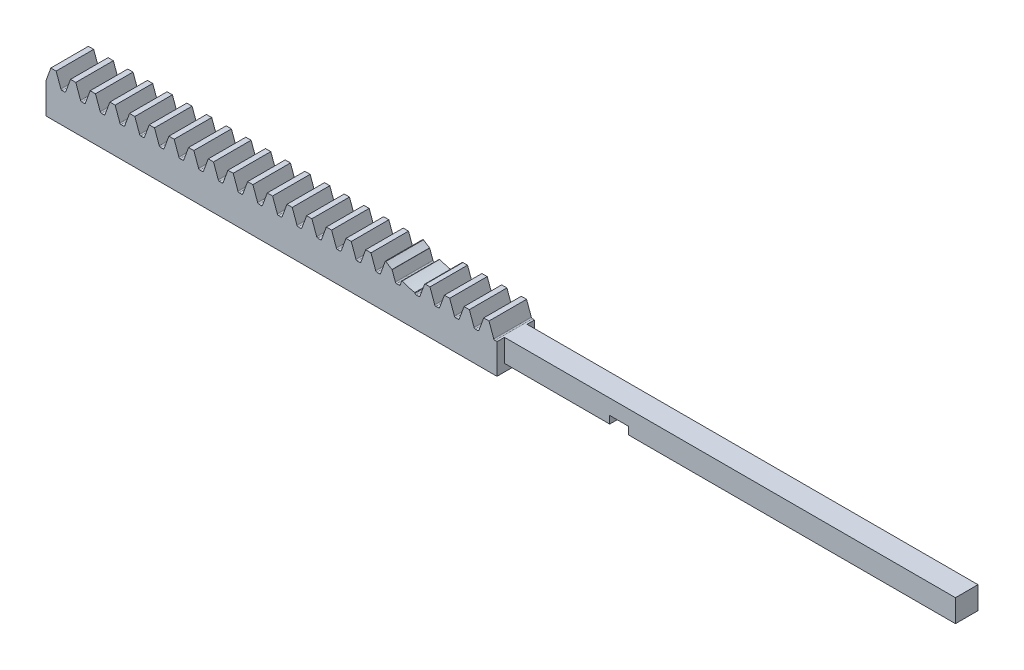
from build123d import *

# Parameters (mm, degrees)
SKETCH1_W                       = 609.6
SKETCH1_H                       = 25.4
BOSS_EXTRUDE1_DEPTH             = 12.7
CUT_EXTRUDE1_DEPTH              = 25.4
FILLET3_R                       = 0.43167355
LPATTERN4_START                 = -12.7
LPATTERN4_DEPTH                 = 25.4
SKETCH5_W                       = 609.6
SKETCH5_H                       = 25.4
CUT_EXTRUDE2_DEPTH              = 10.532533418
SKETCH6_W                       = 609.6
SKETCH6_H                       = 15.910853878
CUT_EXTRUDE3_DEPTH              = 12.7
SKETCH7_W                       = 12.7
SKETCH7_H                       = 14.867466582
CUT_EXTRUDE4_DEPTH              = 457.2
F_1_4_0_25_DIAMETER_HOLE1_D     = 6.35
F_1_4_0_25_DIAMETER_HOLE1_DEPTH = 12.7
F_1_4_0_25_DIAMETER_HOLE1_TIP   = 1.907732465
SKETCH20_W                      = 7.62
SKETCH20_H                      = 7.62
BOSS_EXTRUDE2_DEPTH             = 152.4
CUT_EXTRUDE6_DEPTH              = 12.7
CHAMFER1_SIZE                   = 0.127
CHAMFER1_SIZE2                  = 0.212490963
FILLET4_R                       = 0.127
SKETCH25_W                      = 6.35
SKETCH25_H                      = 7.62
CUT_EXTRUDE7_DEPTH              = 2.54


# Read off the part's stored shape, not the designer's step: LPattern4
with BuildPart() as part:
    # Sketch1 → Boss-Extrude1 (new, symmetric)
    with BuildSketch(Plane.XY):
        Rectangle(SKETCH1_W, SKETCH1_H)
    extrude(amount=BOSS_EXTRUDE1_DEPTH, both=True)

    # Sketch2 → Cut-Extrude1 (cut)
    with BuildSketch(Plane.XY.offset(12.7)):
        Polygon((-303.015947325, 12.7), (-301.30256958, 7.992533333), (-299.863657745, 7.992533333), (-298.15028, 12.7), align=None)
    extrude(amount=-CUT_EXTRUDE1_DEPTH, mode=Mode.SUBTRACT)

    # Fillet3
    fillet3_edges = [part.edges().sort_by_distance(p)[0] for p in [
        (-299.863657745, 7.992533333, 0),
        (-301.30256958, 7.992533333, 0),
    ]]
    fillet(fillet3_edges, radius=FILLET3_R)

    # LPattern4 outline → LPattern4 (cut)
    with BuildSketch(Plane.XY.offset(LPATTERN4_START)):
        with BuildLine():
            ThreePointArc((-294.756228955, 8.276565834), (-294.598186282, 8.070600612), (-294.350588506, 7.992533333))
            Line((-294.350588506, 7.992533333), (-293.516198819, 7.992533333))
            ThreePointArc((-293.516198819, 7.992533333), (-293.268601043, 8.070600612), (-293.11055837, 8.276565834))
            Line((-293.11055837, 8.276565834), (-291.50056, 12.7))
            Line((-291.50056, 12.7), (-296.366227325, 12.7))
            Line((-296.366227325, 12.7), (-294.756228955, 8.276565834))
        make_face()
        with BuildLine():
            Line((304.8, 12.7), (302.108572675, 12.7))
            Line((302.108572675, 12.7), (303.718571045, 8.276565834))
            ThreePointArc((303.718571045, 8.276565834), (303.876613718, 8.070600612), (304.124211494, 7.992533333))
            Line((304.124211494, 7.992533333), (304.8, 7.992533333))
            Line((304.8, 7.992533333), (304.8, 12.7))
        make_face()
        with BuildLine():
            Line((300.32452, 12.7), (295.458852675, 12.7))
            Line((295.458852675, 12.7), (297.068851045, 8.276565834))
            ThreePointArc((297.068851045, 8.276565834), (297.226893718, 8.070600612), (297.474491494, 7.992533333))
            Line((297.474491494, 7.992533333), (298.308881181, 7.992533333))
            ThreePointArc((298.308881181, 7.992533333), (298.556478957, 8.070600612), (298.71452163, 8.276565834))
            Line((298.71452163, 8.276565834), (300.32452, 12.7))
        make_face()
        with BuildLine():
            Line((293.6748, 12.7), (288.809132675, 12.7))
            Line((288.809132675, 12.7), (290.419131045, 8.276565834))
            ThreePointArc((290.419131045, 8.276565834), (290.577173718, 8.070600612), (290.824771494, 7.992533333))
            Line((290.824771494, 7.992533333), (291.659161181, 7.992533333))
            ThreePointArc((291.659161181, 7.992533333), (291.906758957, 8.070600612), (292.06480163, 8.276565834))
            Line((292.06480163, 8.276565834), (293.6748, 12.7))
        make_face()
        with BuildLine():
            Line((287.02508, 12.7), (282.159412675, 12.7))
            Line((282.159412675, 12.7), (283.769411045, 8.276565834))
            ThreePointArc((283.769411045, 8.276565834), (283.927453718, 8.070600612), (284.175051494, 7.992533333))
            Line((284.175051494, 7.992533333), (285.009441181, 7.992533333))
            ThreePointArc((285.009441181, 7.992533333), (285.257038957, 8.070600612), (285.41508163, 8.276565834))
            Line((285.41508163, 8.276565834), (287.02508, 12.7))
        make_face()
        with BuildLine():
            Line((280.37536, 12.7), (275.509692675, 12.7))
            Line((275.509692675, 12.7), (277.119691045, 8.276565834))
            ThreePointArc((277.119691045, 8.276565834), (277.277733718, 8.070600612), (277.525331494, 7.992533333))
            Line((277.525331494, 7.992533333), (278.359721181, 7.992533333))
            ThreePointArc((278.359721181, 7.992533333), (278.607318957, 8.070600612), (278.76536163, 8.276565834))
            Line((278.76536163, 8.276565834), (280.37536, 12.7))
        make_face()
        with BuildLine():
            Line((273.72564, 12.7), (268.859972675, 12.7))
            Line((268.859972675, 12.7), (270.469971045, 8.276565834))
            ThreePointArc((270.469971045, 8.276565834), (270.628013718, 8.070600612), (270.875611494, 7.992533333))
            Line((270.875611494, 7.992533333), (271.710001181, 7.992533333))
            ThreePointArc((271.710001181, 7.992533333), (271.957598957, 8.070600612), (272.11564163, 8.276565834))
            Line((272.11564163, 8.276565834), (273.72564, 12.7))
        make_face()
        with BuildLine():
            Line((267.07592, 12.7), (262.210252675, 12.7))
            Line((262.210252675, 12.7), (263.820251045, 8.276565834))
            ThreePointArc((263.820251045, 8.276565834), (263.978293718, 8.070600612), (264.225891494, 7.992533333))
            Line((264.225891494, 7.992533333), (265.060281181, 7.992533333))
            ThreePointArc((265.060281181, 7.992533333), (265.307878957, 8.070600612), (265.46592163, 8.276565834))
            Line((265.46592163, 8.276565834), (267.07592, 12.7))
        make_face()
        with BuildLine():
            Line((260.4262, 12.7), (255.560532675, 12.7))
            Line((255.560532675, 12.7), (257.170531045, 8.276565834))
            ThreePointArc((257.170531045, 8.276565834), (257.328573718, 8.070600612), (257.576171494, 7.992533333))
            Line((257.576171494, 7.992533333), (258.410561181, 7.992533333))
            ThreePointArc((258.410561181, 7.992533333), (258.658158957, 8.070600612), (258.81620163, 8.276565834))
            Line((258.81620163, 8.276565834), (260.4262, 12.7))
        make_face()
        with BuildLine():
            Line((253.77648, 12.7), (248.910812675, 12.7))
            Line((248.910812675, 12.7), (250.520811045, 8.276565834))
            ThreePointArc((250.520811045, 8.276565834), (250.678853718, 8.070600612), (250.926451494, 7.992533333))
            Line((250.926451494, 7.992533333), (251.760841181, 7.992533333))
            ThreePointArc((251.760841181, 7.992533333), (252.008438957, 8.070600612), (252.16648163, 8.276565834))
            Line((252.16648163, 8.276565834), (253.77648, 12.7))
        make_face()
        with BuildLine():
            Line((247.12676, 12.7), (242.261092675, 12.7))
            Line((242.261092675, 12.7), (243.871091045, 8.276565834))
            ThreePointArc((243.871091045, 8.276565834), (244.029133718, 8.070600612), (244.276731494, 7.992533333))
            Line((244.276731494, 7.992533333), (245.111121181, 7.992533333))
            ThreePointArc((245.111121181, 7.992533333), (245.358718957, 8.070600612), (245.51676163, 8.276565834))
            Line((245.51676163, 8.276565834), (247.12676, 12.7))
        make_face()
        with BuildLine():
            Line((240.47704, 12.7), (235.611372675, 12.7))
            Line((235.611372675, 12.7), (237.221371045, 8.276565834))
            ThreePointArc((237.221371045, 8.276565834), (237.379413718, 8.070600612), (237.627011494, 7.992533333))
            Line((237.627011494, 7.992533333), (238.461401181, 7.992533333))
            ThreePointArc((238.461401181, 7.992533333), (238.708998957, 8.070600612), (238.86704163, 8.276565834))
            Line((238.86704163, 8.276565834), (240.47704, 12.7))
        make_face()
        with BuildLine():
            Line((233.82732, 12.7), (228.961652675, 12.7))
            Line((228.961652675, 12.7), (230.571651045, 8.276565834))
            ThreePointArc((230.571651045, 8.276565834), (230.729693718, 8.070600612), (230.977291494, 7.992533333))
            Line((230.977291494, 7.992533333), (231.811681181, 7.992533333))
            ThreePointArc((231.811681181, 7.992533333), (232.059278957, 8.070600612), (232.21732163, 8.276565834))
            Line((232.21732163, 8.276565834), (233.82732, 12.7))
        make_face()
        with BuildLine():
            Line((227.1776, 12.7), (222.311932675, 12.7))
            Line((222.311932675, 12.7), (223.921931045, 8.276565834))
            ThreePointArc((223.921931045, 8.276565834), (224.079973718, 8.070600612), (224.327571494, 7.992533333))
            Line((224.327571494, 7.992533333), (225.161961181, 7.992533333))
            ThreePointArc((225.161961181, 7.992533333), (225.409558957, 8.070600612), (225.56760163, 8.276565834))
            Line((225.56760163, 8.276565834), (227.1776, 12.7))
        make_face()
        with BuildLine():
            Line((220.52788, 12.7), (215.662212675, 12.7))
            Line((215.662212675, 12.7), (217.272211045, 8.276565834))
            ThreePointArc((217.272211045, 8.276565834), (217.430253718, 8.070600612), (217.677851494, 7.992533333))
            Line((217.677851494, 7.992533333), (218.512241181, 7.992533333))
            ThreePointArc((218.512241181, 7.992533333), (218.759838957, 8.070600612), (218.91788163, 8.276565834))
            Line((218.91788163, 8.276565834), (220.52788, 12.7))
        make_face()
        with BuildLine():
            Line((213.87816, 12.7), (209.012492675, 12.7))
            Line((209.012492675, 12.7), (210.622491045, 8.276565834))
            ThreePointArc((210.622491045, 8.276565834), (210.780533718, 8.070600612), (211.028131494, 7.992533333))
            Line((211.028131494, 7.992533333), (211.862521181, 7.992533333))
            ThreePointArc((211.862521181, 7.992533333), (212.110118957, 8.070600612), (212.26816163, 8.276565834))
            Line((212.26816163, 8.276565834), (213.87816, 12.7))
        make_face()
        with BuildLine():
            Line((207.22844, 12.7), (202.362772675, 12.7))
            Line((202.362772675, 12.7), (203.972771045, 8.276565834))
            ThreePointArc((203.972771045, 8.276565834), (204.130813718, 8.070600612), (204.378411494, 7.992533333))
            Line((204.378411494, 7.992533333), (205.212801181, 7.992533333))
            ThreePointArc((205.212801181, 7.992533333), (205.460398957, 8.070600612), (205.61844163, 8.276565834))
            Line((205.61844163, 8.276565834), (207.22844, 12.7))
        make_face()
        with BuildLine():
            Line((200.57872, 12.7), (195.713052675, 12.7))
            Line((195.713052675, 12.7), (197.323051045, 8.276565834))
            ThreePointArc((197.323051045, 8.276565834), (197.481093718, 8.070600612), (197.728691494, 7.992533333))
            Line((197.728691494, 7.992533333), (198.563081181, 7.992533333))
            ThreePointArc((198.563081181, 7.992533333), (198.810678957, 8.070600612), (198.96872163, 8.276565834))
            Line((198.96872163, 8.276565834), (200.57872, 12.7))
        make_face()
        with BuildLine():
            Line((193.929, 12.7), (189.063332675, 12.7))
            Line((189.063332675, 12.7), (190.673331045, 8.276565834))
            ThreePointArc((190.673331045, 8.276565834), (190.831373718, 8.070600612), (191.078971494, 7.992533333))
            Line((191.078971494, 7.992533333), (191.913361181, 7.992533333))
            ThreePointArc((191.913361181, 7.992533333), (192.160958957, 8.070600612), (192.31900163, 8.276565834))
            Line((192.31900163, 8.276565834), (193.929, 12.7))
        make_face()
        with BuildLine():
            Line((187.27928, 12.7), (182.413612675, 12.7))
            Line((182.413612675, 12.7), (184.023611045, 8.276565834))
            ThreePointArc((184.023611045, 8.276565834), (184.181653718, 8.070600612), (184.429251494, 7.992533333))
            Line((184.429251494, 7.992533333), (185.263641181, 7.992533333))
            ThreePointArc((185.263641181, 7.992533333), (185.511238957, 8.070600612), (185.66928163, 8.276565834))
            Line((185.66928163, 8.276565834), (187.27928, 12.7))
        make_face()
        with BuildLine():
            Line((180.62956, 12.7), (175.763892675, 12.7))
            Line((175.763892675, 12.7), (177.373891045, 8.276565834))
            ThreePointArc((177.373891045, 8.276565834), (177.531933718, 8.070600612), (177.779531494, 7.992533333))
            Line((177.779531494, 7.992533333), (178.613921181, 7.992533333))
            ThreePointArc((178.613921181, 7.992533333), (178.861518957, 8.070600612), (179.01956163, 8.276565834))
            Line((179.01956163, 8.276565834), (180.62956, 12.7))
        make_face()
        with BuildLine():
            Line((173.97984, 12.7), (169.114172675, 12.7))
            Line((169.114172675, 12.7), (170.724171045, 8.276565834))
            ThreePointArc((170.724171045, 8.276565834), (170.882213718, 8.070600612), (171.129811494, 7.992533333))
            Line((171.129811494, 7.992533333), (171.964201181, 7.992533333))
            ThreePointArc((171.964201181, 7.992533333), (172.211798957, 8.070600612), (172.36984163, 8.276565834))
            Line((172.36984163, 8.276565834), (173.97984, 12.7))
        make_face()
        with BuildLine():
            Line((167.33012, 12.7), (162.464452675, 12.7))
            Line((162.464452675, 12.7), (164.074451045, 8.276565834))
            ThreePointArc((164.074451045, 8.276565834), (164.232493718, 8.070600612), (164.480091494, 7.992533333))
            Line((164.480091494, 7.992533333), (165.314481181, 7.992533333))
            ThreePointArc((165.314481181, 7.992533333), (165.562078957, 8.070600612), (165.72012163, 8.276565834))
            Line((165.72012163, 8.276565834), (167.33012, 12.7))
        make_face()
        with BuildLine():
            Line((160.6804, 12.7), (155.814732675, 12.7))
            Line((155.814732675, 12.7), (157.424731045, 8.276565834))
            ThreePointArc((157.424731045, 8.276565834), (157.582773718, 8.070600612), (157.830371494, 7.992533333))
            Line((157.830371494, 7.992533333), (158.664761181, 7.992533333))
            ThreePointArc((158.664761181, 7.992533333), (158.912358957, 8.070600612), (159.07040163, 8.276565834))
            Line((159.07040163, 8.276565834), (160.6804, 12.7))
        make_face()
        with BuildLine():
            Line((154.03068, 12.7), (149.165012675, 12.7))
            Line((149.165012675, 12.7), (150.775011045, 8.276565834))
            ThreePointArc((150.775011045, 8.276565834), (150.933053718, 8.070600612), (151.180651494, 7.992533333))
            Line((151.180651494, 7.992533333), (152.015041181, 7.992533333))
            ThreePointArc((152.015041181, 7.992533333), (152.262638957, 8.070600612), (152.42068163, 8.276565834))
            Line((152.42068163, 8.276565834), (154.03068, 12.7))
        make_face()
        with BuildLine():
            Line((147.38096, 12.7), (142.515292675, 12.7))
            Line((142.515292675, 12.7), (144.125291045, 8.276565834))
            ThreePointArc((144.125291045, 8.276565834), (144.283333718, 8.070600612), (144.530931494, 7.992533333))
            Line((144.530931494, 7.992533333), (145.365321181, 7.992533333))
            ThreePointArc((145.365321181, 7.992533333), (145.612918957, 8.070600612), (145.77096163, 8.276565834))
            Line((145.77096163, 8.276565834), (147.38096, 12.7))
        make_face()
        with BuildLine():
            Line((140.73124, 12.7), (135.865572675, 12.7))
            Line((135.865572675, 12.7), (137.475571045, 8.276565834))
            ThreePointArc((137.475571045, 8.276565834), (137.633613718, 8.070600612), (137.881211494, 7.992533333))
            Line((137.881211494, 7.992533333), (138.715601181, 7.992533333))
            ThreePointArc((138.715601181, 7.992533333), (138.963198957, 8.070600612), (139.12124163, 8.276565834))
            Line((139.12124163, 8.276565834), (140.73124, 12.7))
        make_face()
        with BuildLine():
            Line((134.08152, 12.7), (129.215852675, 12.7))
            Line((129.215852675, 12.7), (130.825851045, 8.276565834))
            ThreePointArc((130.825851045, 8.276565834), (130.983893718, 8.070600612), (131.231491494, 7.992533333))
            Line((131.231491494, 7.992533333), (132.065881181, 7.992533333))
            ThreePointArc((132.065881181, 7.992533333), (132.313478957, 8.070600612), (132.47152163, 8.276565834))
            Line((132.47152163, 8.276565834), (134.08152, 12.7))
        make_face()
        with BuildLine():
            Line((127.4318, 12.7), (122.566132675, 12.7))
            Line((122.566132675, 12.7), (124.176131045, 8.276565834))
            ThreePointArc((124.176131045, 8.276565834), (124.334173718, 8.070600612), (124.581771494, 7.992533333))
            Line((124.581771494, 7.992533333), (125.416161181, 7.992533333))
            ThreePointArc((125.416161181, 7.992533333), (125.663758957, 8.070600612), (125.82180163, 8.276565834))
            Line((125.82180163, 8.276565834), (127.4318, 12.7))
        make_face()
        with BuildLine():
            Line((120.78208, 12.7), (115.916412675, 12.7))
            Line((115.916412675, 12.7), (117.526411045, 8.276565834))
            ThreePointArc((117.526411045, 8.276565834), (117.684453718, 8.070600612), (117.932051494, 7.992533333))
            Line((117.932051494, 7.992533333), (118.766441181, 7.992533333))
            ThreePointArc((118.766441181, 7.992533333), (119.014038957, 8.070600612), (119.17208163, 8.276565834))
            Line((119.17208163, 8.276565834), (120.78208, 12.7))
        make_face()
        with BuildLine():
            Line((114.13236, 12.7), (109.266692675, 12.7))
            Line((109.266692675, 12.7), (110.876691045, 8.276565834))
            ThreePointArc((110.876691045, 8.276565834), (111.034733718, 8.070600612), (111.282331494, 7.992533333))
            Line((111.282331494, 7.992533333), (112.116721181, 7.992533333))
            ThreePointArc((112.116721181, 7.992533333), (112.364318957, 8.070600612), (112.52236163, 8.276565834))
            Line((112.52236163, 8.276565834), (114.13236, 12.7))
        make_face()
        with BuildLine():
            Line((107.48264, 12.7), (102.616972675, 12.7))
            Line((102.616972675, 12.7), (104.226971045, 8.276565834))
            ThreePointArc((104.226971045, 8.276565834), (104.385013718, 8.070600612), (104.632611494, 7.992533333))
            Line((104.632611494, 7.992533333), (105.467001181, 7.992533333))
            ThreePointArc((105.467001181, 7.992533333), (105.714598957, 8.070600612), (105.87264163, 8.276565834))
            Line((105.87264163, 8.276565834), (107.48264, 12.7))
        make_face()
        with BuildLine():
            Line((100.83292, 12.7), (95.967252675, 12.7))
            Line((95.967252675, 12.7), (97.577251045, 8.276565834))
            ThreePointArc((97.577251045, 8.276565834), (97.735293718, 8.070600612), (97.982891494, 7.992533333))
            Line((97.982891494, 7.992533333), (98.817281181, 7.992533333))
            ThreePointArc((98.817281181, 7.992533333), (99.064878957, 8.070600612), (99.22292163, 8.276565834))
            Line((99.22292163, 8.276565834), (100.83292, 12.7))
        make_face()
        with BuildLine():
            Line((94.1832, 12.7), (89.317532675, 12.7))
            Line((89.317532675, 12.7), (90.927531045, 8.276565834))
            ThreePointArc((90.927531045, 8.276565834), (91.085573718, 8.070600612), (91.333171494, 7.992533333))
            Line((91.333171494, 7.992533333), (92.167561181, 7.992533333))
            ThreePointArc((92.167561181, 7.992533333), (92.415158957, 8.070600612), (92.57320163, 8.276565834))
            Line((92.57320163, 8.276565834), (94.1832, 12.7))
        make_face()
        with BuildLine():
            Line((87.53348, 12.7), (82.667812675, 12.7))
            Line((82.667812675, 12.7), (84.277811045, 8.276565834))
            ThreePointArc((84.277811045, 8.276565834), (84.435853718, 8.070600612), (84.683451494, 7.992533333))
            Line((84.683451494, 7.992533333), (85.517841181, 7.992533333))
            ThreePointArc((85.517841181, 7.992533333), (85.765438957, 8.070600612), (85.92348163, 8.276565834))
            Line((85.92348163, 8.276565834), (87.53348, 12.7))
        make_face()
        with BuildLine():
            Line((80.88376, 12.7), (76.018092675, 12.7))
            Line((76.018092675, 12.7), (77.628091045, 8.276565834))
            ThreePointArc((77.628091045, 8.276565834), (77.786133718, 8.070600612), (78.033731494, 7.992533333))
            Line((78.033731494, 7.992533333), (78.868121181, 7.992533333))
            ThreePointArc((78.868121181, 7.992533333), (79.115718957, 8.070600612), (79.27376163, 8.276565834))
            Line((79.27376163, 8.276565834), (80.88376, 12.7))
        make_face()
        with BuildLine():
            Line((74.23404, 12.7), (69.368372675, 12.7))
            Line((69.368372675, 12.7), (70.978371045, 8.276565834))
            ThreePointArc((70.978371045, 8.276565834), (71.136413718, 8.070600612), (71.384011494, 7.992533333))
            Line((71.384011494, 7.992533333), (72.218401181, 7.992533333))
            ThreePointArc((72.218401181, 7.992533333), (72.465998957, 8.070600612), (72.62404163, 8.276565834))
            Line((72.62404163, 8.276565834), (74.23404, 12.7))
        make_face()
        with BuildLine():
            Line((67.58432, 12.7), (62.718652675, 12.7))
            Line((62.718652675, 12.7), (64.328651045, 8.276565834))
            ThreePointArc((64.328651045, 8.276565834), (64.486693718, 8.070600612), (64.734291494, 7.992533333))
            Line((64.734291494, 7.992533333), (65.568681181, 7.992533333))
            ThreePointArc((65.568681181, 7.992533333), (65.816278957, 8.070600612), (65.97432163, 8.276565834))
            Line((65.97432163, 8.276565834), (67.58432, 12.7))
        make_face()
        with BuildLine():
            Line((60.9346, 12.7), (56.068932675, 12.7))
            Line((56.068932675, 12.7), (57.678931045, 8.276565834))
            ThreePointArc((57.678931045, 8.276565834), (57.836973718, 8.070600612), (58.084571494, 7.992533333))
            Line((58.084571494, 7.992533333), (58.918961181, 7.992533333))
            ThreePointArc((58.918961181, 7.992533333), (59.166558957, 8.070600612), (59.32460163, 8.276565834))
            Line((59.32460163, 8.276565834), (60.9346, 12.7))
        make_face()
        with BuildLine():
            Line((54.28488, 12.7), (49.419212675, 12.7))
            Line((49.419212675, 12.7), (51.029211045, 8.276565834))
            ThreePointArc((51.029211045, 8.276565834), (51.187253718, 8.070600612), (51.434851494, 7.992533333))
            Line((51.434851494, 7.992533333), (52.269241181, 7.992533333))
            ThreePointArc((52.269241181, 7.992533333), (52.516838957, 8.070600612), (52.67488163, 8.276565834))
            Line((52.67488163, 8.276565834), (54.28488, 12.7))
        make_face()
        with BuildLine():
            Line((47.63516, 12.7), (42.769492675, 12.7))
            Line((42.769492675, 12.7), (44.379491045, 8.276565834))
            ThreePointArc((44.379491045, 8.276565834), (44.537533718, 8.070600612), (44.785131494, 7.992533333))
            Line((44.785131494, 7.992533333), (45.619521181, 7.992533333))
            ThreePointArc((45.619521181, 7.992533333), (45.867118957, 8.070600612), (46.02516163, 8.276565834))
            Line((46.02516163, 8.276565834), (47.63516, 12.7))
        make_face()
        with BuildLine():
            Line((40.98544, 12.7), (36.119772675, 12.7))
            Line((36.119772675, 12.7), (37.729771045, 8.276565834))
            ThreePointArc((37.729771045, 8.276565834), (37.887813718, 8.070600612), (38.135411494, 7.992533333))
            Line((38.135411494, 7.992533333), (38.969801181, 7.992533333))
            ThreePointArc((38.969801181, 7.992533333), (39.217398957, 8.070600612), (39.37544163, 8.276565834))
            Line((39.37544163, 8.276565834), (40.98544, 12.7))
        make_face()
        with BuildLine():
            Line((34.33572, 12.7), (29.470052675, 12.7))
            Line((29.470052675, 12.7), (31.080051045, 8.276565834))
            ThreePointArc((31.080051045, 8.276565834), (31.238093718, 8.070600612), (31.485691494, 7.992533333))
            Line((31.485691494, 7.992533333), (32.320081181, 7.992533333))
            ThreePointArc((32.320081181, 7.992533333), (32.567678957, 8.070600612), (32.72572163, 8.276565834))
            Line((32.72572163, 8.276565834), (34.33572, 12.7))
        make_face()
        with BuildLine():
            Line((27.686, 12.7), (22.820332675, 12.7))
            Line((22.820332675, 12.7), (24.430331045, 8.276565834))
            ThreePointArc((24.430331045, 8.276565834), (24.588373718, 8.070600612), (24.835971494, 7.992533333))
            Line((24.835971494, 7.992533333), (25.670361181, 7.992533333))
            ThreePointArc((25.670361181, 7.992533333), (25.917958957, 8.070600612), (26.07600163, 8.276565834))
            Line((26.07600163, 8.276565834), (27.686, 12.7))
        make_face()
        with BuildLine():
            Line((21.03628, 12.7), (16.170612675, 12.7))
            Line((16.170612675, 12.7), (17.780611045, 8.276565834))
            ThreePointArc((17.780611045, 8.276565834), (17.938653718, 8.070600612), (18.186251494, 7.992533333))
            Line((18.186251494, 7.992533333), (19.020641181, 7.992533333))
            ThreePointArc((19.020641181, 7.992533333), (19.268238957, 8.070600612), (19.42628163, 8.276565834))
            Line((19.42628163, 8.276565834), (21.03628, 12.7))
        make_face()
        with BuildLine():
            Line((14.38656, 12.7), (9.520892675, 12.7))
            Line((9.520892675, 12.7), (11.130891045, 8.276565834))
            ThreePointArc((11.130891045, 8.276565834), (11.288933718, 8.070600612), (11.536531494, 7.992533333))
            Line((11.536531494, 7.992533333), (12.370921181, 7.992533333))
            ThreePointArc((12.370921181, 7.992533333), (12.618518957, 8.070600612), (12.77656163, 8.276565834))
            Line((12.77656163, 8.276565834), (14.38656, 12.7))
        make_face()
        with BuildLine():
            Line((7.73684, 12.7), (2.871172675, 12.7))
            Line((2.871172675, 12.7), (4.481171045, 8.276565834))
            ThreePointArc((4.481171045, 8.276565834), (4.639213718, 8.070600612), (4.886811494, 7.992533333))
            Line((4.886811494, 7.992533333), (5.721201181, 7.992533333))
            ThreePointArc((5.721201181, 7.992533333), (5.968798957, 8.070600612), (6.12684163, 8.276565834))
            Line((6.12684163, 8.276565834), (7.73684, 12.7))
        make_face()
        with BuildLine():
            Line((1.08712, 12.7), (-3.778547325, 12.7))
            Line((-3.778547325, 12.7), (-2.168548955, 8.276565834))
            ThreePointArc((-2.168548955, 8.276565834), (-2.010506282, 8.070600612), (-1.762908506, 7.992533333))
            Line((-1.762908506, 7.992533333), (-0.928518819, 7.992533333))
            ThreePointArc((-0.928518819, 7.992533333), (-0.680921043, 8.070600612), (-0.52287837, 8.276565834))
            Line((-0.52287837, 8.276565834), (1.08712, 12.7))
        make_face()
        with BuildLine():
            Line((-5.5626, 12.7), (-10.428267325, 12.7))
            Line((-10.428267325, 12.7), (-8.818268955, 8.276565834))
            ThreePointArc((-8.818268955, 8.276565834), (-8.660226282, 8.070600612), (-8.412628506, 7.992533333))
            Line((-8.412628506, 7.992533333), (-7.578238819, 7.992533333))
            ThreePointArc((-7.578238819, 7.992533333), (-7.330641043, 8.070600612), (-7.17259837, 8.276565834))
            Line((-7.17259837, 8.276565834), (-5.5626, 12.7))
        make_face()
        with BuildLine():
            Line((-12.21232, 12.7), (-17.077987325, 12.7))
            Line((-17.077987325, 12.7), (-15.467988955, 8.276565834))
            ThreePointArc((-15.467988955, 8.276565834), (-15.309946282, 8.070600612), (-15.062348506, 7.992533333))
            Line((-15.062348506, 7.992533333), (-14.227958819, 7.992533333))
            ThreePointArc((-14.227958819, 7.992533333), (-13.980361043, 8.070600612), (-13.82231837, 8.276565834))
            Line((-13.82231837, 8.276565834), (-12.21232, 12.7))
        make_face()
        with BuildLine():
            Line((-18.86204, 12.7), (-23.727707325, 12.7))
            Line((-23.727707325, 12.7), (-22.117708955, 8.276565834))
            ThreePointArc((-22.117708955, 8.276565834), (-21.959666282, 8.070600612), (-21.712068506, 7.992533333))
            Line((-21.712068506, 7.992533333), (-20.877678819, 7.992533333))
            ThreePointArc((-20.877678819, 7.992533333), (-20.630081043, 8.070600612), (-20.47203837, 8.276565834))
            Line((-20.47203837, 8.276565834), (-18.86204, 12.7))
        make_face()
        with BuildLine():
            Line((-25.51176, 12.7), (-30.377427325, 12.7))
            Line((-30.377427325, 12.7), (-28.767428955, 8.276565834))
            ThreePointArc((-28.767428955, 8.276565834), (-28.609386282, 8.070600612), (-28.361788506, 7.992533333))
            Line((-28.361788506, 7.992533333), (-27.527398819, 7.992533333))
            ThreePointArc((-27.527398819, 7.992533333), (-27.279801043, 8.070600612), (-27.12175837, 8.276565834))
            Line((-27.12175837, 8.276565834), (-25.51176, 12.7))
        make_face()
        with BuildLine():
            Line((-32.16148, 12.7), (-37.027147325, 12.7))
            Line((-37.027147325, 12.7), (-35.417148955, 8.276565834))
            ThreePointArc((-35.417148955, 8.276565834), (-35.259106282, 8.070600612), (-35.011508506, 7.992533333))
            Line((-35.011508506, 7.992533333), (-34.177118819, 7.992533333))
            ThreePointArc((-34.177118819, 7.992533333), (-33.929521043, 8.070600612), (-33.77147837, 8.276565834))
            Line((-33.77147837, 8.276565834), (-32.16148, 12.7))
        make_face()
        with BuildLine():
            Line((-38.8112, 12.7), (-43.676867325, 12.7))
            Line((-43.676867325, 12.7), (-42.066868955, 8.276565834))
            ThreePointArc((-42.066868955, 8.276565834), (-41.908826282, 8.070600612), (-41.661228506, 7.992533333))
            Line((-41.661228506, 7.992533333), (-40.826838819, 7.992533333))
            ThreePointArc((-40.826838819, 7.992533333), (-40.579241043, 8.070600612), (-40.42119837, 8.276565834))
            Line((-40.42119837, 8.276565834), (-38.8112, 12.7))
        make_face()
        with BuildLine():
            Line((-45.46092, 12.7), (-50.326587325, 12.7))
            Line((-50.326587325, 12.7), (-48.716588955, 8.276565834))
            ThreePointArc((-48.716588955, 8.276565834), (-48.558546282, 8.070600612), (-48.310948506, 7.992533333))
            Line((-48.310948506, 7.992533333), (-47.476558819, 7.992533333))
            ThreePointArc((-47.476558819, 7.992533333), (-47.228961043, 8.070600612), (-47.07091837, 8.276565834))
            Line((-47.07091837, 8.276565834), (-45.46092, 12.7))
        make_face()
        with BuildLine():
            Line((-52.11064, 12.7), (-56.976307325, 12.7))
            Line((-56.976307325, 12.7), (-55.366308955, 8.276565834))
            ThreePointArc((-55.366308955, 8.276565834), (-55.208266282, 8.070600612), (-54.960668506, 7.992533333))
            Line((-54.960668506, 7.992533333), (-54.126278819, 7.992533333))
            ThreePointArc((-54.126278819, 7.992533333), (-53.878681043, 8.070600612), (-53.72063837, 8.276565834))
            Line((-53.72063837, 8.276565834), (-52.11064, 12.7))
        make_face()
        with BuildLine():
            Line((-58.76036, 12.7), (-63.626027325, 12.7))
            Line((-63.626027325, 12.7), (-62.016028955, 8.276565834))
            ThreePointArc((-62.016028955, 8.276565834), (-61.857986282, 8.070600612), (-61.610388506, 7.992533333))
            Line((-61.610388506, 7.992533333), (-60.775998819, 7.992533333))
            ThreePointArc((-60.775998819, 7.992533333), (-60.528401043, 8.070600612), (-60.37035837, 8.276565834))
            Line((-60.37035837, 8.276565834), (-58.76036, 12.7))
        make_face()
        with BuildLine():
            Line((-65.41008, 12.7), (-70.275747325, 12.7))
            Line((-70.275747325, 12.7), (-68.665748955, 8.276565834))
            ThreePointArc((-68.665748955, 8.276565834), (-68.507706282, 8.070600612), (-68.260108506, 7.992533333))
            Line((-68.260108506, 7.992533333), (-67.425718819, 7.992533333))
            ThreePointArc((-67.425718819, 7.992533333), (-67.178121043, 8.070600612), (-67.02007837, 8.276565834))
            Line((-67.02007837, 8.276565834), (-65.41008, 12.7))
        make_face()
        with BuildLine():
            Line((-72.0598, 12.7), (-76.925467325, 12.7))
            Line((-76.925467325, 12.7), (-75.315468955, 8.276565834))
            ThreePointArc((-75.315468955, 8.276565834), (-75.157426282, 8.070600612), (-74.909828506, 7.992533333))
            Line((-74.909828506, 7.992533333), (-74.075438819, 7.992533333))
            ThreePointArc((-74.075438819, 7.992533333), (-73.827841043, 8.070600612), (-73.66979837, 8.276565834))
            Line((-73.66979837, 8.276565834), (-72.0598, 12.7))
        make_face()
        with BuildLine():
            Line((-78.70952, 12.7), (-83.575187325, 12.7))
            Line((-83.575187325, 12.7), (-81.965188955, 8.276565834))
            ThreePointArc((-81.965188955, 8.276565834), (-81.807146282, 8.070600612), (-81.559548506, 7.992533333))
            Line((-81.559548506, 7.992533333), (-80.725158819, 7.992533333))
            ThreePointArc((-80.725158819, 7.992533333), (-80.477561043, 8.070600612), (-80.31951837, 8.276565834))
            Line((-80.31951837, 8.276565834), (-78.70952, 12.7))
        make_face()
        with BuildLine():
            Line((-85.35924, 12.7), (-90.224907325, 12.7))
            Line((-90.224907325, 12.7), (-88.614908955, 8.276565834))
            ThreePointArc((-88.614908955, 8.276565834), (-88.456866282, 8.070600612), (-88.209268506, 7.992533333))
            Line((-88.209268506, 7.992533333), (-87.374878819, 7.992533333))
            ThreePointArc((-87.374878819, 7.992533333), (-87.127281043, 8.070600612), (-86.96923837, 8.276565834))
            Line((-86.96923837, 8.276565834), (-85.35924, 12.7))
        make_face()
        with BuildLine():
            Line((-92.00896, 12.7), (-96.874627325, 12.7))
            Line((-96.874627325, 12.7), (-95.264628955, 8.276565834))
            ThreePointArc((-95.264628955, 8.276565834), (-95.106586282, 8.070600612), (-94.858988506, 7.992533333))
            Line((-94.858988506, 7.992533333), (-94.024598819, 7.992533333))
            ThreePointArc((-94.024598819, 7.992533333), (-93.777001043, 8.070600612), (-93.61895837, 8.276565834))
            Line((-93.61895837, 8.276565834), (-92.00896, 12.7))
        make_face()
        with BuildLine():
            Line((-98.65868, 12.7), (-103.524347325, 12.7))
            Line((-103.524347325, 12.7), (-101.914348955, 8.276565834))
            ThreePointArc((-101.914348955, 8.276565834), (-101.756306282, 8.070600612), (-101.508708506, 7.992533333))
            Line((-101.508708506, 7.992533333), (-100.674318819, 7.992533333))
            ThreePointArc((-100.674318819, 7.992533333), (-100.426721043, 8.070600612), (-100.26867837, 8.276565834))
            Line((-100.26867837, 8.276565834), (-98.65868, 12.7))
        make_face()
        with BuildLine():
            Line((-105.3084, 12.7), (-110.174067325, 12.7))
            Line((-110.174067325, 12.7), (-108.564068955, 8.276565834))
            ThreePointArc((-108.564068955, 8.276565834), (-108.406026282, 8.070600612), (-108.158428506, 7.992533333))
            Line((-108.158428506, 7.992533333), (-107.324038819, 7.992533333))
            ThreePointArc((-107.324038819, 7.992533333), (-107.076441043, 8.070600612), (-106.91839837, 8.276565834))
            Line((-106.91839837, 8.276565834), (-105.3084, 12.7))
        make_face()
        with BuildLine():
            Line((-111.95812, 12.7), (-116.823787325, 12.7))
            Line((-116.823787325, 12.7), (-115.213788955, 8.276565834))
            ThreePointArc((-115.213788955, 8.276565834), (-115.055746282, 8.070600612), (-114.808148506, 7.992533333))
            Line((-114.808148506, 7.992533333), (-113.973758819, 7.992533333))
            ThreePointArc((-113.973758819, 7.992533333), (-113.726161043, 8.070600612), (-113.56811837, 8.276565834))
            Line((-113.56811837, 8.276565834), (-111.95812, 12.7))
        make_face()
        with BuildLine():
            Line((-118.60784, 12.7), (-123.473507325, 12.7))
            Line((-123.473507325, 12.7), (-121.863508955, 8.276565834))
            ThreePointArc((-121.863508955, 8.276565834), (-121.705466282, 8.070600612), (-121.457868506, 7.992533333))
            Line((-121.457868506, 7.992533333), (-120.623478819, 7.992533333))
            ThreePointArc((-120.623478819, 7.992533333), (-120.375881043, 8.070600612), (-120.21783837, 8.276565834))
            Line((-120.21783837, 8.276565834), (-118.60784, 12.7))
        make_face()
        with BuildLine():
            Line((-125.25756, 12.7), (-130.123227325, 12.7))
            Line((-130.123227325, 12.7), (-128.513228955, 8.276565834))
            ThreePointArc((-128.513228955, 8.276565834), (-128.355186282, 8.070600612), (-128.107588506, 7.992533333))
            Line((-128.107588506, 7.992533333), (-127.273198819, 7.992533333))
            ThreePointArc((-127.273198819, 7.992533333), (-127.025601043, 8.070600612), (-126.86755837, 8.276565834))
            Line((-126.86755837, 8.276565834), (-125.25756, 12.7))
        make_face()
        with BuildLine():
            Line((-131.90728, 12.7), (-136.772947325, 12.7))
            Line((-136.772947325, 12.7), (-135.162948955, 8.276565834))
            ThreePointArc((-135.162948955, 8.276565834), (-135.004906282, 8.070600612), (-134.757308506, 7.992533333))
            Line((-134.757308506, 7.992533333), (-133.922918819, 7.992533333))
            ThreePointArc((-133.922918819, 7.992533333), (-133.675321043, 8.070600612), (-133.51727837, 8.276565834))
            Line((-133.51727837, 8.276565834), (-131.90728, 12.7))
        make_face()
        with BuildLine():
            Line((-138.557, 12.7), (-143.422667325, 12.7))
            Line((-143.422667325, 12.7), (-141.812668955, 8.276565834))
            ThreePointArc((-141.812668955, 8.276565834), (-141.654626282, 8.070600612), (-141.407028506, 7.992533333))
            Line((-141.407028506, 7.992533333), (-140.572638819, 7.992533333))
            ThreePointArc((-140.572638819, 7.992533333), (-140.325041043, 8.070600612), (-140.16699837, 8.276565834))
            Line((-140.16699837, 8.276565834), (-138.557, 12.7))
        make_face()
        with BuildLine():
            Line((-145.20672, 12.7), (-150.072387325, 12.7))
            Line((-150.072387325, 12.7), (-148.462388955, 8.276565834))
            ThreePointArc((-148.462388955, 8.276565834), (-148.304346282, 8.070600612), (-148.056748506, 7.992533333))
            Line((-148.056748506, 7.992533333), (-147.222358819, 7.992533333))
            ThreePointArc((-147.222358819, 7.992533333), (-146.974761043, 8.070600612), (-146.81671837, 8.276565834))
            Line((-146.81671837, 8.276565834), (-145.20672, 12.7))
        make_face()
        with BuildLine():
            Line((-151.85644, 12.7), (-156.722107325, 12.7))
            Line((-156.722107325, 12.7), (-155.112108955, 8.276565834))
            ThreePointArc((-155.112108955, 8.276565834), (-154.954066282, 8.070600612), (-154.706468506, 7.992533333))
            Line((-154.706468506, 7.992533333), (-153.872078819, 7.992533333))
            ThreePointArc((-153.872078819, 7.992533333), (-153.624481043, 8.070600612), (-153.46643837, 8.276565834))
            Line((-153.46643837, 8.276565834), (-151.85644, 12.7))
        make_face()
        with BuildLine():
            Line((-158.50616, 12.7), (-163.371827325, 12.7))
            Line((-163.371827325, 12.7), (-161.761828955, 8.276565834))
            ThreePointArc((-161.761828955, 8.276565834), (-161.603786282, 8.070600612), (-161.356188506, 7.992533333))
            Line((-161.356188506, 7.992533333), (-160.521798819, 7.992533333))
            ThreePointArc((-160.521798819, 7.992533333), (-160.274201043, 8.070600612), (-160.11615837, 8.276565834))
            Line((-160.11615837, 8.276565834), (-158.50616, 12.7))
        make_face()
        with BuildLine():
            Line((-165.15588, 12.7), (-170.021547325, 12.7))
            Line((-170.021547325, 12.7), (-168.411548955, 8.276565834))
            ThreePointArc((-168.411548955, 8.276565834), (-168.253506282, 8.070600612), (-168.005908506, 7.992533333))
            Line((-168.005908506, 7.992533333), (-167.171518819, 7.992533333))
            ThreePointArc((-167.171518819, 7.992533333), (-166.923921043, 8.070600612), (-166.76587837, 8.276565834))
            Line((-166.76587837, 8.276565834), (-165.15588, 12.7))
        make_face()
        with BuildLine():
            Line((-171.8056, 12.7), (-176.671267325, 12.7))
            Line((-176.671267325, 12.7), (-175.061268955, 8.276565834))
            ThreePointArc((-175.061268955, 8.276565834), (-174.903226282, 8.070600612), (-174.655628506, 7.992533333))
            Line((-174.655628506, 7.992533333), (-173.821238819, 7.992533333))
            ThreePointArc((-173.821238819, 7.992533333), (-173.573641043, 8.070600612), (-173.41559837, 8.276565834))
            Line((-173.41559837, 8.276565834), (-171.8056, 12.7))
        make_face()
        with BuildLine():
            Line((-178.45532, 12.7), (-183.320987325, 12.7))
            Line((-183.320987325, 12.7), (-181.710988955, 8.276565834))
            ThreePointArc((-181.710988955, 8.276565834), (-181.552946282, 8.070600612), (-181.305348506, 7.992533333))
            Line((-181.305348506, 7.992533333), (-180.470958819, 7.992533333))
            ThreePointArc((-180.470958819, 7.992533333), (-180.223361043, 8.070600612), (-180.06531837, 8.276565834))
            Line((-180.06531837, 8.276565834), (-178.45532, 12.7))
        make_face()
        with BuildLine():
            Line((-185.10504, 12.7), (-189.970707325, 12.7))
            Line((-189.970707325, 12.7), (-188.360708955, 8.276565834))
            ThreePointArc((-188.360708955, 8.276565834), (-188.202666282, 8.070600612), (-187.955068506, 7.992533333))
            Line((-187.955068506, 7.992533333), (-187.120678819, 7.992533333))
            ThreePointArc((-187.120678819, 7.992533333), (-186.873081043, 8.070600612), (-186.71503837, 8.276565834))
            Line((-186.71503837, 8.276565834), (-185.10504, 12.7))
        make_face()
        with BuildLine():
            Line((-191.75476, 12.7), (-196.620427325, 12.7))
            Line((-196.620427325, 12.7), (-195.010428955, 8.276565834))
            ThreePointArc((-195.010428955, 8.276565834), (-194.852386282, 8.070600612), (-194.604788506, 7.992533333))
            Line((-194.604788506, 7.992533333), (-193.770398819, 7.992533333))
            ThreePointArc((-193.770398819, 7.992533333), (-193.522801043, 8.070600612), (-193.36475837, 8.276565834))
            Line((-193.36475837, 8.276565834), (-191.75476, 12.7))
        make_face()
        with BuildLine():
            Line((-198.40448, 12.7), (-203.270147325, 12.7))
            Line((-203.270147325, 12.7), (-201.660148955, 8.276565834))
            ThreePointArc((-201.660148955, 8.276565834), (-201.502106282, 8.070600612), (-201.254508506, 7.992533333))
            Line((-201.254508506, 7.992533333), (-200.420118819, 7.992533333))
            ThreePointArc((-200.420118819, 7.992533333), (-200.172521043, 8.070600612), (-200.01447837, 8.276565834))
            Line((-200.01447837, 8.276565834), (-198.40448, 12.7))
        make_face()
        with BuildLine():
            Line((-205.0542, 12.7), (-209.919867325, 12.7))
            Line((-209.919867325, 12.7), (-208.309868955, 8.276565834))
            ThreePointArc((-208.309868955, 8.276565834), (-208.151826282, 8.070600612), (-207.904228506, 7.992533333))
            Line((-207.904228506, 7.992533333), (-207.069838819, 7.992533333))
            ThreePointArc((-207.069838819, 7.992533333), (-206.822241043, 8.070600612), (-206.66419837, 8.276565834))
            Line((-206.66419837, 8.276565834), (-205.0542, 12.7))
        make_face()
        with BuildLine():
            Line((-211.70392, 12.7), (-216.569587325, 12.7))
            Line((-216.569587325, 12.7), (-214.959588955, 8.276565834))
            ThreePointArc((-214.959588955, 8.276565834), (-214.801546282, 8.070600612), (-214.553948506, 7.992533333))
            Line((-214.553948506, 7.992533333), (-213.719558819, 7.992533333))
            ThreePointArc((-213.719558819, 7.992533333), (-213.471961043, 8.070600612), (-213.31391837, 8.276565834))
            Line((-213.31391837, 8.276565834), (-211.70392, 12.7))
        make_face()
        with BuildLine():
            Line((-218.35364, 12.7), (-223.219307325, 12.7))
            Line((-223.219307325, 12.7), (-221.609308955, 8.276565834))
            ThreePointArc((-221.609308955, 8.276565834), (-221.451266282, 8.070600612), (-221.203668506, 7.992533333))
            Line((-221.203668506, 7.992533333), (-220.369278819, 7.992533333))
            ThreePointArc((-220.369278819, 7.992533333), (-220.121681043, 8.070600612), (-219.96363837, 8.276565834))
            Line((-219.96363837, 8.276565834), (-218.35364, 12.7))
        make_face()
        with BuildLine():
            Line((-225.00336, 12.7), (-229.869027325, 12.7))
            Line((-229.869027325, 12.7), (-228.259028955, 8.276565834))
            ThreePointArc((-228.259028955, 8.276565834), (-228.100986282, 8.070600612), (-227.853388506, 7.992533333))
            Line((-227.853388506, 7.992533333), (-227.018998819, 7.992533333))
            ThreePointArc((-227.018998819, 7.992533333), (-226.771401043, 8.070600612), (-226.61335837, 8.276565834))
            Line((-226.61335837, 8.276565834), (-225.00336, 12.7))
        make_face()
        with BuildLine():
            Line((-231.65308, 12.7), (-236.518747325, 12.7))
            Line((-236.518747325, 12.7), (-234.908748955, 8.276565834))
            ThreePointArc((-234.908748955, 8.276565834), (-234.750706282, 8.070600612), (-234.503108506, 7.992533333))
            Line((-234.503108506, 7.992533333), (-233.668718819, 7.992533333))
            ThreePointArc((-233.668718819, 7.992533333), (-233.421121043, 8.070600612), (-233.26307837, 8.276565834))
            Line((-233.26307837, 8.276565834), (-231.65308, 12.7))
        make_face()
        with BuildLine():
            Line((-238.3028, 12.7), (-243.168467325, 12.7))
            Line((-243.168467325, 12.7), (-241.558468955, 8.276565834))
            ThreePointArc((-241.558468955, 8.276565834), (-241.400426282, 8.070600612), (-241.152828506, 7.992533333))
            Line((-241.152828506, 7.992533333), (-240.318438819, 7.992533333))
            ThreePointArc((-240.318438819, 7.992533333), (-240.070841043, 8.070600612), (-239.91279837, 8.276565834))
            Line((-239.91279837, 8.276565834), (-238.3028, 12.7))
        make_face()
        with BuildLine():
            Line((-244.95252, 12.7), (-249.818187325, 12.7))
            Line((-249.818187325, 12.7), (-248.208188955, 8.276565834))
            ThreePointArc((-248.208188955, 8.276565834), (-248.050146282, 8.070600612), (-247.802548506, 7.992533333))
            Line((-247.802548506, 7.992533333), (-246.968158819, 7.992533333))
            ThreePointArc((-246.968158819, 7.992533333), (-246.720561043, 8.070600612), (-246.56251837, 8.276565834))
            Line((-246.56251837, 8.276565834), (-244.95252, 12.7))
        make_face()
        with BuildLine():
            Line((-251.60224, 12.7), (-256.467907325, 12.7))
            Line((-256.467907325, 12.7), (-254.857908955, 8.276565834))
            ThreePointArc((-254.857908955, 8.276565834), (-254.699866282, 8.070600612), (-254.452268506, 7.992533333))
            Line((-254.452268506, 7.992533333), (-253.617878819, 7.992533333))
            ThreePointArc((-253.617878819, 7.992533333), (-253.370281043, 8.070600612), (-253.21223837, 8.276565834))
            Line((-253.21223837, 8.276565834), (-251.60224, 12.7))
        make_face()
        with BuildLine():
            Line((-258.25196, 12.7), (-263.117627325, 12.7))
            Line((-263.117627325, 12.7), (-261.507628955, 8.276565834))
            ThreePointArc((-261.507628955, 8.276565834), (-261.349586282, 8.070600612), (-261.101988506, 7.992533333))
            Line((-261.101988506, 7.992533333), (-260.267598819, 7.992533333))
            ThreePointArc((-260.267598819, 7.992533333), (-260.020001043, 8.070600612), (-259.86195837, 8.276565834))
            Line((-259.86195837, 8.276565834), (-258.25196, 12.7))
        make_face()
        with BuildLine():
            Line((-264.90168, 12.7), (-269.767347325, 12.7))
            Line((-269.767347325, 12.7), (-268.157348955, 8.276565834))
            ThreePointArc((-268.157348955, 8.276565834), (-267.999306282, 8.070600612), (-267.751708506, 7.992533333))
            Line((-267.751708506, 7.992533333), (-266.917318819, 7.992533333))
            ThreePointArc((-266.917318819, 7.992533333), (-266.669721043, 8.070600612), (-266.51167837, 8.276565834))
            Line((-266.51167837, 8.276565834), (-264.90168, 12.7))
        make_face()
        with BuildLine():
            Line((-271.5514, 12.7), (-276.417067325, 12.7))
            Line((-276.417067325, 12.7), (-274.807068955, 8.276565834))
            ThreePointArc((-274.807068955, 8.276565834), (-274.649026282, 8.070600612), (-274.401428506, 7.992533333))
            Line((-274.401428506, 7.992533333), (-273.567038819, 7.992533333))
            ThreePointArc((-273.567038819, 7.992533333), (-273.319441043, 8.070600612), (-273.16139837, 8.276565834))
            Line((-273.16139837, 8.276565834), (-271.5514, 12.7))
        make_face()
        with BuildLine():
            Line((-278.20112, 12.7), (-283.066787325, 12.7))
            Line((-283.066787325, 12.7), (-281.456788955, 8.276565834))
            ThreePointArc((-281.456788955, 8.276565834), (-281.298746282, 8.070600612), (-281.051148506, 7.992533333))
            Line((-281.051148506, 7.992533333), (-280.216758819, 7.992533333))
            ThreePointArc((-280.216758819, 7.992533333), (-279.969161043, 8.070600612), (-279.81111837, 8.276565834))
            Line((-279.81111837, 8.276565834), (-278.20112, 12.7))
        make_face()
        with BuildLine():
            Line((-284.85084, 12.7), (-289.716507325, 12.7))
            Line((-289.716507325, 12.7), (-288.106508955, 8.276565834))
            ThreePointArc((-288.106508955, 8.276565834), (-287.948466282, 8.070600612), (-287.700868506, 7.992533333))
            Line((-287.700868506, 7.992533333), (-286.866478819, 7.992533333))
            ThreePointArc((-286.866478819, 7.992533333), (-286.618881043, 8.070600612), (-286.46083837, 8.276565834))
            Line((-286.46083837, 8.276565834), (-284.85084, 12.7))
        make_face()
    extrude(amount=LPATTERN4_DEPTH, mode=Mode.SUBTRACT)

    # Sketch5 → Cut-Extrude2 (cut)
    with BuildSketch(Plane.XZ.offset(12.7)):
        Rectangle(SKETCH5_W, SKETCH5_H)
    extrude(amount=-CUT_EXTRUDE2_DEPTH, mode=Mode.SUBTRACT)

    # Sketch6 → Cut-Extrude3 (cut)
    with BuildSketch(Plane.XY.offset(12.7)):
        with Locations((0, 5.787960357)):
            Rectangle(SKETCH6_W, SKETCH6_H)
    extrude(amount=-CUT_EXTRUDE3_DEPTH, mode=Mode.SUBTRACT)

    # Sketch7 → Cut-Extrude4 (cut)
    with BuildSketch(Plane.ZY.offset(304.8)):
        with Locations((-6.35, 5.266266709)):
            Rectangle(SKETCH7_W, SKETCH7_H)
    extrude(amount=-CUT_EXTRUDE4_DEPTH, mode=Mode.SUBTRACT)

    # 1/4 (0.25) Diameter Hole1
    with Locations(Plane.ZY.offset(-152.4)):
        with Locations((-6.35, 4.182533418)):
            Hole(F_1_4_0_25_DIAMETER_HOLE1_D / 2, depth=F_1_4_0_25_DIAMETER_HOLE1_DEPTH)
            with Locations((0, 0, -(F_1_4_0_25_DIAMETER_HOLE1_DEPTH + F_1_4_0_25_DIAMETER_HOLE1_TIP / 2))):  # 118° drill point
                Cone(0, F_1_4_0_25_DIAMETER_HOLE1_D / 2, F_1_4_0_25_DIAMETER_HOLE1_TIP, mode=Mode.SUBTRACT)

    # Sketch20 → Boss-Extrude2 (add)
    with BuildSketch(Plane(origin=(304.8, 0, 0), x_dir=(0, 0, -1), z_dir=(1, 0, 0))):
        with Locations((6.35, 4.182533418)):
            Rectangle(SKETCH20_W, SKETCH20_H)
    extrude(amount=BOSS_EXTRUDE2_DEPTH)

    # Sketch24 → Cut-Extrude6 (cut)
    with BuildSketch(Plane.XY):
        with BuildLine():
            ThreePointArc((277.657315225, 57.182376248), (257.033063457, 32.766), (277.657315225, 8.349623752))
            Line((277.657315225, 8.349623752), (277.657315225, 57.182376248))
        make_face()
    extrude(amount=-CUT_EXTRUDE6_DEPTH, mode=Mode.SUBTRACT)

    # Chamfer1
    chamfer1_edges = [part.edges().sort_by_distance(p)[0] for p in [
        (280.37536, 12.7, -6.35),
    ]]
    chamfer1_side = [part.faces().sort_by_distance(p)[0] for p in [
        (279.570360815, 10.488282917, -6.35),
    ]]
    chamfer(chamfer1_edges, length=CHAMFER1_SIZE, length2=CHAMFER1_SIZE2, reference=chamfer1_side[0])

    # Fillet4
    fillet4_edges = [part.edges().sort_by_distance(p)[0] for p in [
        (277.052985016, 8.459839144, -6.35),
        (269.34851947, 11.357728713, -6.35),
        (272.652499988, 9.751572051, -6.35),
    ]]
    fillet(fillet4_edges, radius=FILLET4_R)

    # Sketch25 → Cut-Extrude7 (cut)
    with BuildSketch(Plane.XZ.offset(-0.372533418)):
        with Locations((343.535, -6.35)):
            Rectangle(SKETCH25_W, SKETCH25_H)
    extrude(amount=-CUT_EXTRUDE7_DEPTH, mode=Mode.SUBTRACT)


solid = part.part
